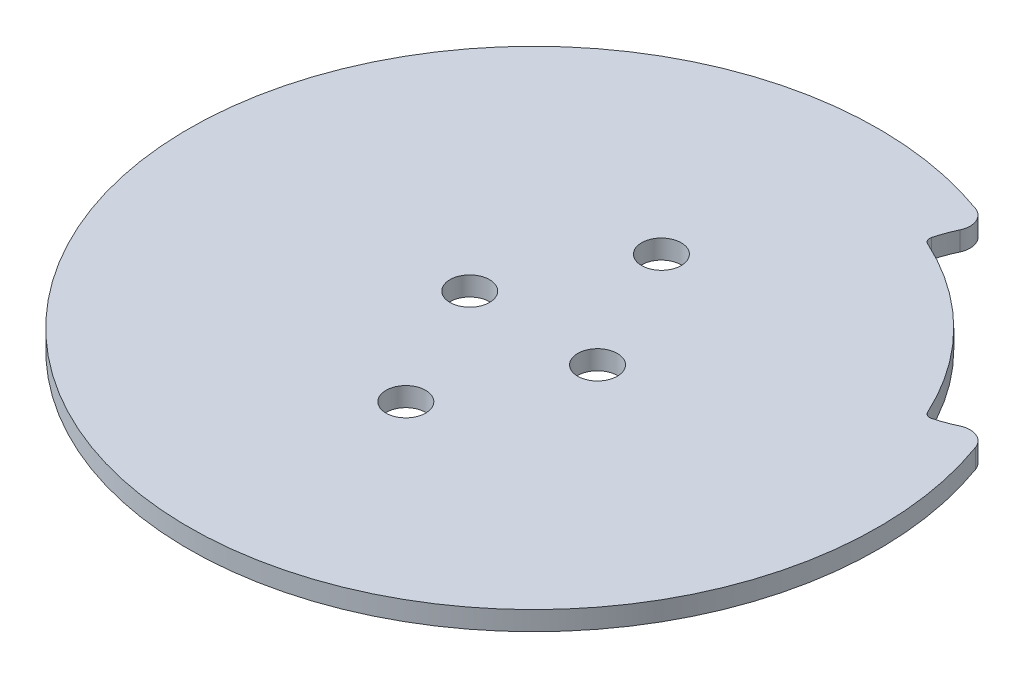
from build123d import *

# Parameters (mm, degrees)
SKETCH1_R           = 3.1
BOSS_EXTRUDE1_DEPTH = 3
FILLET1_R           = 3
FILLET2_R           = 1


with BuildPart() as part:
    # Sketch1 → Boss-Extrude1 (new body)
    with BuildSketch(Plane(origin=(0, 0, 0), x_dir=(1, 0, 0), z_dir=(0, 1, 0))):
        with BuildLine():
            ThreePointArc((21.667324002, 49.462380357), (-38.183766184, -38.183766184), (49.462380357, 21.667324002))
            ThreePointArc((49.462380357, 21.667324002), (46.165505457, 19.845504593), (42.585510083, 18.674162122))
            ThreePointArc((42.585510083, 18.674162122), (32.880465325, 32.880465325), (18.674162122, 42.585510083))
            ThreePointArc((18.674162122, 42.585510083), (19.845504593, 46.165505457), (21.667324002, 49.462380357))
        make_face()
        with Locations((10, 0)):
            Circle(SKETCH1_R, mode=Mode.SUBTRACT)
        with Locations((0, 20)):
            Circle(SKETCH1_R, mode=Mode.SUBTRACT)
        with Locations((0, -20)):
            Circle(SKETCH1_R, mode=Mode.SUBTRACT)
        with Locations((-10, 0)):
            Circle(SKETCH1_R, mode=Mode.SUBTRACT)
    extrude(amount=BOSS_EXTRUDE1_DEPTH)

    # Fillet1
    fillet1_edges = [part.edges().sort_by_distance(p)[0] for p in [
        (49.462380357, 1.5, -21.667324002),
        (21.667324002, 1.5, -49.462380357),
    ]]
    fillet(fillet1_edges, radius=FILLET1_R)

    # Fillet2
    fillet2_edges = [part.edges().sort_by_distance(p)[0] for p in [
        (42.585510083, 1.5, -18.674162122),
        (18.674162122, 1.5, -42.585510083),
    ]]
    fillet(fillet2_edges, radius=FILLET2_R)


solid = part.part
